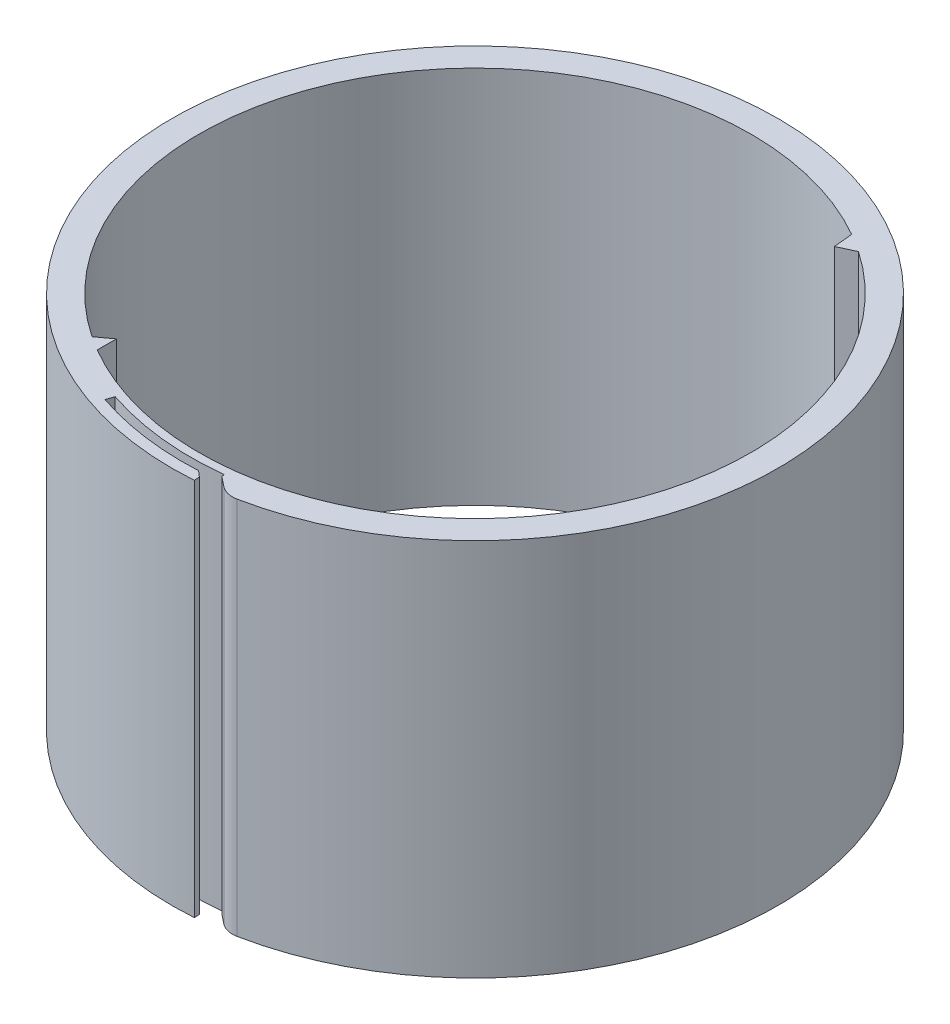
from build123d import *

# Parameters (mm, degrees)
SKETCH_1_R      = 25.5
EXTRUDE_1_DEPTH = 35
CHAMFER_1_SIZE  = 1.5
FILLET_1_R      = 2
CHAMFER_2_SIZE  = 0.5


with BuildPart() as part:
    # Эскиз1 → Бобышка-Вытянуть1 (new body)
    # profile 1 of 3: a face of its own
    with BuildSketch(Plane(origin=(0, 65.667309681, 0), x_dir=(-1, 0, 0), z_dir=(0, -1, 0))):
        with BuildLine():
            ThreePointArc((-32.569554052, -57.83154498), (-26.905120992, -2.121558707), (-31.457793139, -57.933399285))
            Line((-31.457793139, -57.933399285), (-31.386430924, -56.935948818))
            ThreePointArc((-31.386430924, -56.935948818), (-26.058947255, -56.789767316), (-20.863962526, -55.599983748))
            Line((-20.863962526, -55.599983748), (-21.100431285, -54.895855797))
            ThreePointArc((-21.100431285, -54.895855797), (-26.672454195, -56.113662764), (-32.375987665, -56.099553559))
            Line((-32.375987665, -56.099553559), (-32.569554052, -57.83154498))
        make_face()
        with Locations((-29.45965114, -30.004786206)):
            Circle(SKETCH_1_R, mode=Mode.SUBTRACT)
    # profile 2 of 3: a face of its own
    with BuildSketch(Plane(origin=(0, 65.667309681, 0), x_dir=(-1, 0, 0), z_dir=(0, -1, 0))):
        with BuildLine():
            ThreePointArc((-42.146247167, -7.884653267), (-43.001975074, -8.397947879), (-43.836965332, -8.944329501))
            Line((-43.836965332, -8.944329501), (-42.312872357, -9.648278017))
            Line((-42.312872357, -9.648278017), (-42.146247167, -7.884653267))
        make_face()
    # profile 3 of 3: a face of its own
    with BuildSketch(Plane(origin=(0, 65.667309681, 0), x_dir=(-1, 0, 0), z_dir=(0, -1, 0))):
        with BuildLine():
            Line((-16.534234919, -50.219751552), (-16.534234919, -51.986224182))
            ThreePointArc((-16.534234919, -51.986224182), (-15.879111186, -51.587625096), (-15.236269322, -51.169507079))
            Line((-15.236269322, -51.169507079), (-16.534234919, -50.219751552))
        make_face()
    extrude(amount=EXTRUDE_1_DEPTH)

    # Фаска1
    # the kernel refuses this chamfer: 1.5 mm, written as the material it takes off along each edge
    with BuildSketch(Plane(origin=(32.569554052, 69.524834163, 57.83154498), x_dir=(0.9905736381961588, 0, -0.13698126627690838), z_dir=(0, -1, 0))) as chamfer_1_piece_1:
        with BuildLine():
            Line((1.462313623, 0), (CHAMFER_1_SIZE * 0.0261127432615, -CHAMFER_1_SIZE * 0.999659004181))
            Line((CHAMFER_1_SIZE * 0.0261127432615, -CHAMFER_1_SIZE * 0.999659004181), (0, 0))
            ThreePointArc((0, 0), (0.751799837, 0.009540273), (1.462313623, 0))
        make_face()
    extrude(amount=42.715048964, mode=Mode.SUBTRACT)

    # Скругление1
    fillet_1_edges = [part.edges().sort_by_distance(p)[0] for p in [
        (34.018083377, 48.167309681, 57.631235408),
    ]]
    fillet(fillet_1_edges, radius=FILLET_1_R)

    # Фаска2
    # the kernel refuses this chamfer: 0.5 mm, written as the material it takes off along each edge
    with BuildSketch(Plane(origin=(31.386430924, 66.965316212, 56.935948818), x_dir=(0.0713622142429535, 0, 0.9974504671302444), z_dir=(0, -1, 0))) as chamfer_2_piece_1:
        with BuildLine():
            Line((CHAMFER_2_SIZE, 0), (-0.004717821, 0.504717821))
            ThreePointArc((-0.004717821, 0.504717821), (-0.001247153, 0.259508631), (0, 0))
            Line((0, 0), (CHAMFER_2_SIZE, 0))
        make_face()
    extrude(amount=37.596013061, mode=Mode.SUBTRACT)


solid = part.part
